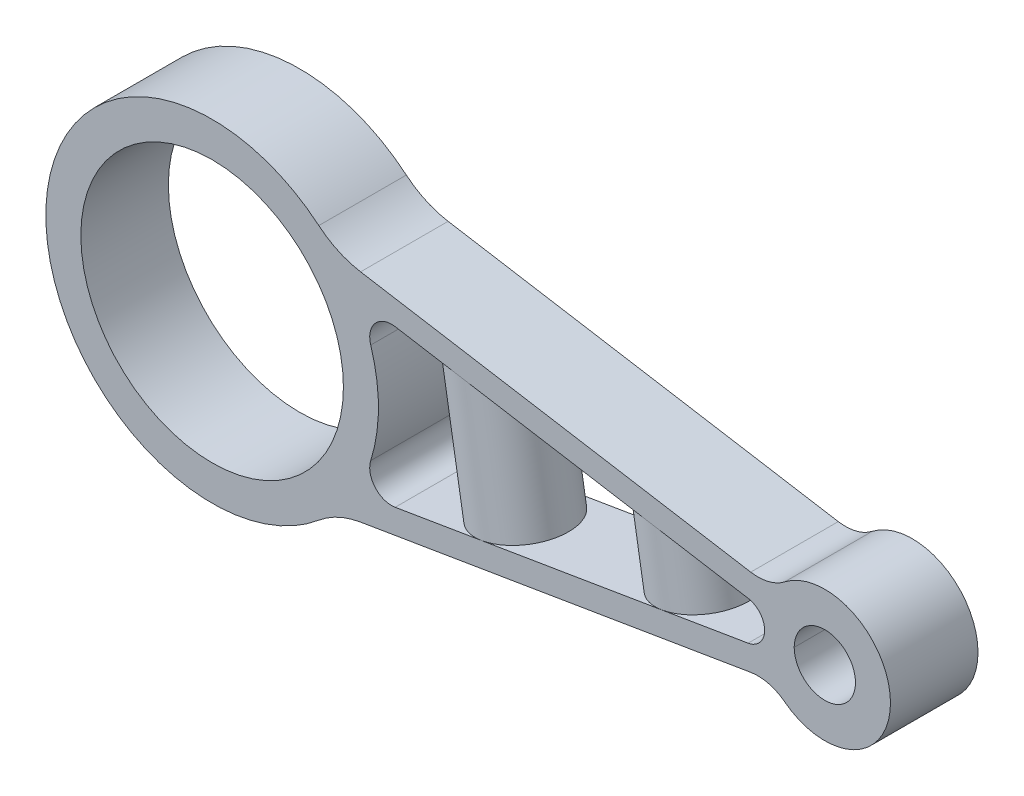
from build123d import *

# Parameters (mm, degrees)
SKETCH1_R           = 30
SKETCH1_R_2         = 7
BOSS_EXTRUDE1_DEPTH = 10
FILLET1_R           = 20
FILLET2_R           = 10
FILLET3_R           = 20
FILLET4_R           = 10
CUT_EXTRUDE3_DEPTH  = 171.328236543
BOSS_EXTRUDE2_REACH = 172.875
SKETCH3_R           = 10


with BuildPart() as part:
    # Sketch1 → Boss-Extrude1 (new, symmetric)
    with BuildSketch(Plane.XY):
        with BuildLine():
            Line((-98.890823266, 25.760615491), (1.237458527, 9.084385863))
            ThreePointArc((1.237458527, 9.084385863), (28.173703058, 0), (1.237458527, -9.084385863))
            Line((1.237458527, -9.084385863), (-98.890823266, -25.760615491))
            ThreePointArc((-98.890823266, -25.760615491), (-164.826296942, 0), (-98.890823266, 25.760615491))
        make_face()
        with Locations((-126.826296942, 0)):
            Circle(SKETCH1_R, mode=Mode.SUBTRACT)
        with Locations((13.173703058, 0)):
            Circle(SKETCH1_R_2, mode=Mode.SUBTRACT)
    extrude(amount=BOSS_EXTRUDE1_DEPTH, both=True)

    # Fillet1
    fillet1_edges = [part.edges().sort_by_distance(p)[0] for p in [
        (-98.890823266, 25.760615491, 0),
    ]]
    fillet(fillet1_edges, radius=FILLET1_R)

    # Fillet2
    fillet2_edges = [part.edges().sort_by_distance(p)[0] for p in [
        (1.237458527, 9.084385863, 0),
    ]]
    fillet(fillet2_edges, radius=FILLET2_R)

    # Fillet3
    fillet3_edges = [part.edges().sort_by_distance(p)[0] for p in [
        (-98.890823266, -25.760615491, 0),
    ]]
    fillet(fillet3_edges, radius=FILLET3_R)

    # Fillet4
    fillet4_edges = [part.edges().sort_by_distance(p)[0] for p in [
        (1.237458527, -9.084385863, 0),
    ]]
    fillet(fillet4_edges, radius=FILLET4_R)

    # Sketch2 → Cut-Extrude3 (cut, through all)
    with BuildSketch(Plane.XY.offset(10)):
        with BuildLine():
            Line((-84.997742384, -17.870982725), (-4.347880793, -4.438857582))
            ThreePointArc((-4.347880793, -4.438857582), (-0.587166508, 0), (-4.347880793, 4.438857582))
            Line((-4.347880793, 4.438857582), (-84.997742384, 17.870982725))
            ThreePointArc((-84.997742384, 17.870982725), (-89.594328046, 16.217361812), (-90.587441419, 11.43439331))
            ThreePointArc((-90.587441419, 11.43439331), (-88.826296942, 0), (-90.587441419, -11.43439331))
            ThreePointArc((-90.587441419, -11.43439331), (-89.594328046, -16.217361812), (-84.997742384, -17.870982725))
        make_face()
    extrude(amount=-CUT_EXTRUDE3_DEPTH, mode=Mode.SUBTRACT)

    # Sketch3 → Boss-Extrude2 (add, up to next)
    with BuildSketch(Plane(origin=(0.601984128, -3.614464288, 0), x_dir=(0.9864127959843347, 0.16428571428571423, 0), z_dir=(-0.16428571428571423, 0.9864127959843347, 0)), mode=Mode.PRIVATE) as boss_extrude2_sk1:
        with Locations((-66.778807879, 0)):
            Circle(SKETCH3_R)
    boss_extrude2_tool1 = extrude(boss_extrude2_sk1.sketch, amount=BOSS_EXTRUDE2_REACH, mode=Mode.PRIVATE) - part.part
    # Sketch3 → Boss-Extrude2 (add, up to next)
    with BuildSketch(Plane(origin=(0.601984128, -3.614464288, 0), x_dir=(0.9864127959843347, 0.16428571428571423, 0), z_dir=(-0.16428571428571423, 0.9864127959843347, 0)), mode=Mode.PRIVATE) as boss_extrude2_sk2:
        with Locations((-25.018046138, 0)):
            Circle(SKETCH3_R)
    boss_extrude2_tool2 = extrude(boss_extrude2_sk2.sketch, amount=BOSS_EXTRUDE2_REACH, mode=Mode.PRIVATE) - part.part
    add(boss_extrude2_tool1.solids().sort_by_distance((-65.269486, -14.585268, 0))[0])
    add(boss_extrude2_tool2.solids().sort_by_distance((-24.076137, -7.724572, 0))[0])


solid = part.part
